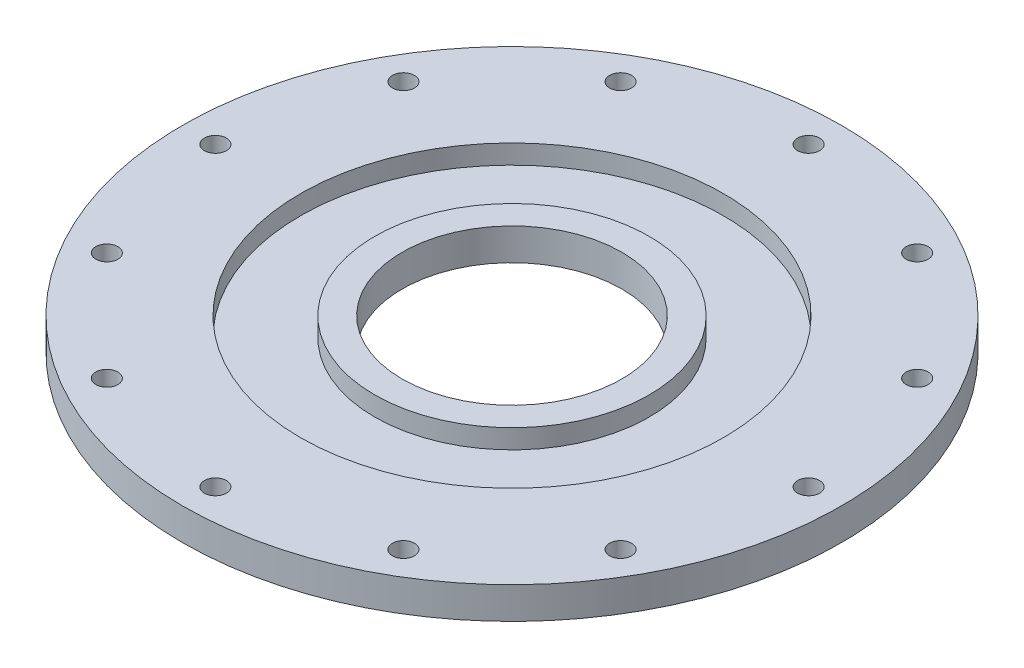
from build123d import *

# Parameters (mm, degrees)
SKETCH1_R           = 60
SKETCH1_R_2         = 20
BOSS_EXTRUDE1_DEPTH = 5.8
SKETCH2_R           = 38.5
SKETCH2_R_2         = 25
CUT_EXTRUDE1_DEPTH  = 3.5
SKETCH3_R           = 2
CUT_EXTRUDE2_DEPTH  = 86.050808344


with BuildPart() as part:
    # Sketch1 → Boss-Extrude1 (new body)
    with BuildSketch(Plane(origin=(0, 0, 0), x_dir=(1, 0, 0), z_dir=(0, 1, 0))):
        Circle(SKETCH1_R)
        Circle(SKETCH1_R_2, mode=Mode.SUBTRACT)
    extrude(amount=BOSS_EXTRUDE1_DEPTH)

    # Sketch2 → Cut-Extrude1 (cut)
    with BuildSketch(Plane(origin=(0, 5.8, 0), x_dir=(1, 0, 0), z_dir=(0, 1, 0))):
        Circle(SKETCH2_R)
        Circle(SKETCH2_R_2, mode=Mode.SUBTRACT)
    extrude(amount=-CUT_EXTRUDE1_DEPTH, mode=Mode.SUBTRACT)

    # Sketch3 → Cut-Extrude2 (cut, through all)
    with BuildSketch(Plane(origin=(0, 5.8, 0), x_dir=(1, 0, 0), z_dir=(0, 1, 0))):
        with Locations((0, 54)):
            Circle(SKETCH3_R)
        with Locations((27, 46.765371804)):
            Circle(SKETCH3_R)
        with Locations((46.765371804, 27)):
            Circle(SKETCH3_R)
        with Locations((54, 0)):
            Circle(SKETCH3_R)
        with Locations((46.765371804, -27)):
            Circle(SKETCH3_R)
        with Locations((27, -46.765371804)):
            Circle(SKETCH3_R)
        with Locations((0, -54)):
            Circle(SKETCH3_R)
        with Locations((-27, -46.765371804)):
            Circle(SKETCH3_R)
        with Locations((-46.765371804, -27)):
            Circle(SKETCH3_R)
        with Locations((-54, 0)):
            Circle(SKETCH3_R)
        with Locations((-46.765371804, 27)):
            Circle(SKETCH3_R)
        with Locations((-27, 46.765371804)):
            Circle(SKETCH3_R)
    extrude(amount=-CUT_EXTRUDE2_DEPTH, mode=Mode.SUBTRACT)


solid = part.part
